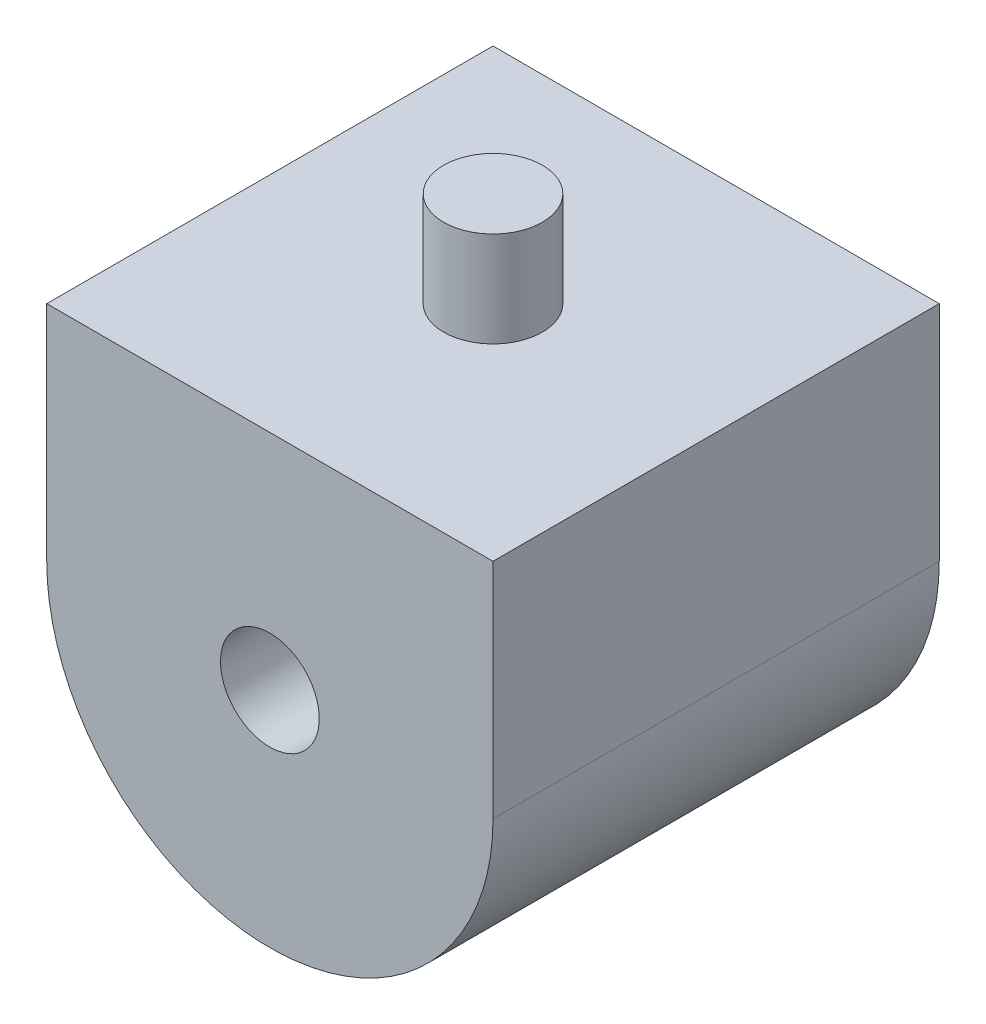
from build123d import *

# Parameters (mm, degrees)
BOSS_EXTRUDE1_DEPTH = 38.1
SKETCH2_R           = 4.2164
CUT_EXTRUDE1_DEPTH  = 38.1
SKETCH3_R           = 4.2164
BOSS_EXTRUDE2_DEPTH = 8.128


with BuildPart() as part:
    # Sketch1 → Boss-Extrude1 (new body)
    with BuildSketch(Plane.XY):
        with BuildLine():
            Line((-19.05, -9.525), (-19.05, 9.525))
            Line((-19.05, 9.525), (19.05, 9.525))
            Line((19.05, 9.525), (19.05, -9.525))
            ThreePointArc((19.05, -9.525), (0, -28.575), (-19.05, -9.525))
        make_face()
    extrude(amount=BOSS_EXTRUDE1_DEPTH)

    # Sketch2 → Cut-Extrude1 (cut)
    with BuildSketch(Plane(origin=(0, 0, 0), x_dir=(-1, 0, 0), z_dir=(0, 0, -1))):
        with Locations((0, -9.525)):
            Circle(SKETCH2_R)
    extrude(amount=-CUT_EXTRUDE1_DEPTH, mode=Mode.SUBTRACT)

    # Sketch3 → Boss-Extrude2 (add)
    with BuildSketch(Plane(origin=(0, 9.525, 0), x_dir=(1, 0, 0), z_dir=(0, 1, 0))):
        with Locations((0, -19.05)):
            Circle(SKETCH3_R)
    extrude(amount=BOSS_EXTRUDE2_DEPTH)


solid = part.part
